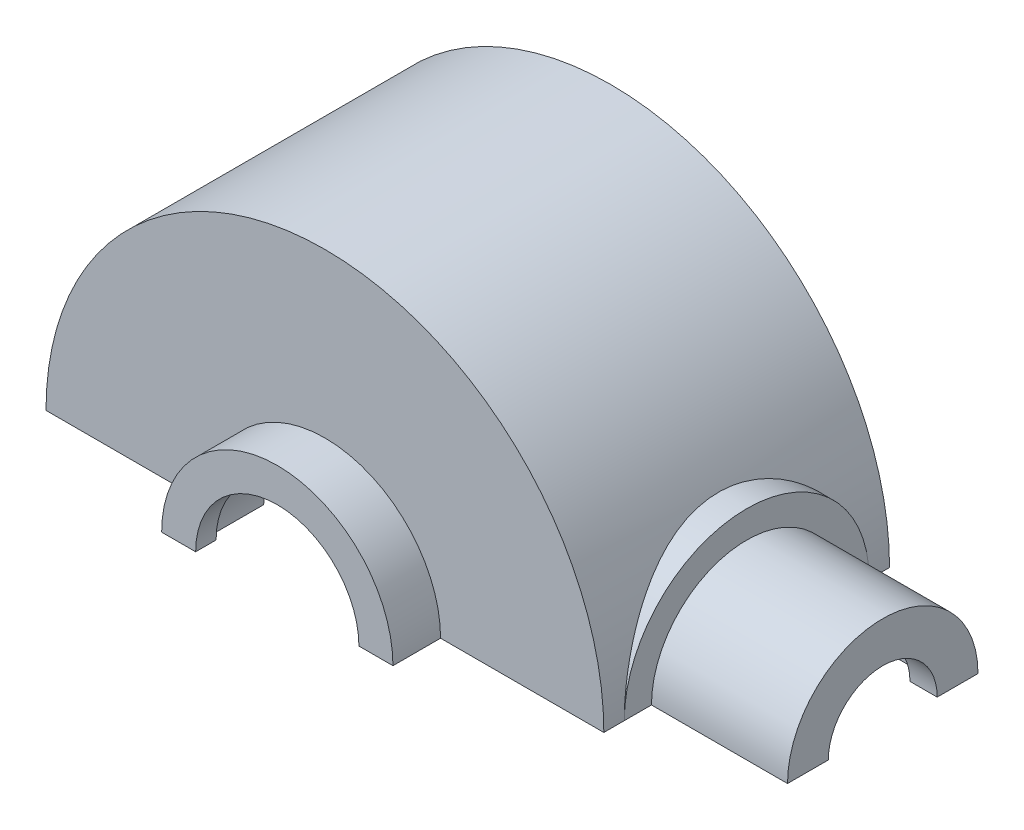
from build123d import *

# Parameters (mm, degrees)
REVOLVE1_ANGLE          = 180
SHELL1_START            = -8.5
SHELL1_DEPTH            = 17
SHELL1_START_2          = -12
SHELL1_2_DEPTH          = 24
CUT_EXTRUDE1_DEPTH      = 33.194720064
CUT_EXTRUDE1_DEPTH_BACK = 33.194720064
SKETCH3_R               = 6
BOSS_EXTRUDE1_REACH     = 49.93
SKETCH6_R               = 9
BOSS_EXTRUDE3_DEPTH     = 10
SHELL2_START            = 19.880907618
SHELL2_DEPTH            = 8.619092382
SHELL2_START_2          = -5.0000001
SHELL2_2_DEPTH          = 10.0000001
CUT_EXTRUDE2_REACH      = 41.326
SKETCH8_R               = 5
SKETCH9_R               = 4
CUT_EXTRUDE3_DEPTH      = 10
BOSS_EXTRUDE4_START     = -1
BOSS_EXTRUDE4_DEPTH     = 1
SKETCH11_R              = 2.5
CUT_EXTRUDE4_DEPTH      = 1
CUT_EXTRUDE6_DEPTH      = 12.5
CUT_EXTRUDE6_DEPTH_BACK = 12.5
SKETCH12_R              = 6.5


with BuildPart() as part:
    # Sketch2 → Revolve1 (revolve)
    with BuildSketch(Plane(origin=(0, 0, 0), x_dir=(1, 0, 0), z_dir=(0, 1, 0))):
        Polygon((0, 0), (0, 14), (-8.5, 14), (-8.5, 10.5), (-20.5, 10.5), (-20.5, 0), (-20.5, -10.5), (-8.5, -10.5), (-8.5, -14), (0, -14), align=None)
    revolve(axis=Axis((0, 0, 0), (0, 0, -1)), revolution_arc=REVOLVE1_ANGLE)

    # Shell1: read off the stored shape, not the designer's step
    # Shell1 outline → Shell1 (cut)
    with BuildSketch(Plane.XY.offset(SHELL1_START)):
        with BuildLine():
            ThreePointArc((18.5, 0), (0, 18.5), (-18.5, 0))
            Line((-18.5, 0), (18.5, 0))
        make_face()
    extrude(amount=SHELL1_DEPTH, mode=Mode.SUBTRACT)

    # Shell1 2 outline → Shell1 2 (cut)
    with BuildSketch(Plane.XY.offset(SHELL1_START_2)):
        with BuildLine():
            Line((-6.5, 0), (6.5, 0))
            ThreePointArc((6.5, 0), (0, 6.5), (-6.5, 0))
        make_face()
    extrude(amount=SHELL1_2_DEPTH, mode=Mode.SUBTRACT)

    # Sketch3 → Cut-Extrude1 (cut, two sides: drawn at the far end of the back side and taken through both)
    with BuildSketch(Plane.XY.offset(-CUT_EXTRUDE1_DEPTH_BACK)):
        Circle(SKETCH3_R)
    extrude(amount=CUT_EXTRUDE1_DEPTH + CUT_EXTRUDE1_DEPTH_BACK, mode=Mode.SUBTRACT)

    # Sketch6 → Boss-Extrude1 (add, up to next)
    with BuildSketch(Plane(origin=(20.5, 0, 0), x_dir=(0, 0, -1), z_dir=(1, 0, 0)), mode=Mode.PRIVATE) as boss_extrude1_sk1:
        Circle(SKETCH6_R)
    boss_extrude1_tool1 = extrude(boss_extrude1_sk1.sketch, amount=-BOSS_EXTRUDE1_REACH, mode=Mode.PRIVATE) - part.part
    add(boss_extrude1_tool1.solids().sort_by_distance((20.5, 0, 0))[0])

    # Sketch7 → Boss-Extrude3 (add)
    with BuildSketch(Plane(origin=(20.5, 0, 0), x_dir=(0, 0, -1), z_dir=(1, 0, 0))):
        with BuildLine():
            Line((-7, 0), (7, 0))
            ThreePointArc((7, 0), (0, 7), (-7, 0))
        make_face()
    extrude(amount=BOSS_EXTRUDE3_DEPTH)

    # Shell2: read off the stored shape, not the designer's step
    # Shell2 outline → Shell2 (cut)
    with BuildSketch(Plane.YZ.offset(SHELL2_START)):
        with BuildLine():
            ThreePointArc((0, -5), (5, 0), (0, 5))
            Line((0, 5), (0, -5))
        make_face()
    extrude(amount=SHELL2_DEPTH, mode=Mode.SUBTRACT)

    # Shell2 2 outline → Shell2 2 (add)
    with BuildSketch(Plane.XY.offset(SHELL2_START_2)):
        with BuildLine():
            Line((19.880896081, 4.999997099), (19.880907618, 0))
            Line((19.880907618, 0), (20.5, 0))
            ThreePointArc((20.5, 0), (20.344635284, 2.519090146), (19.880896081, 4.999997099))
        make_face()
    extrude(amount=SHELL2_2_DEPTH)

    # Sketch8 → Cut-Extrude2 (cut, up to next)
    with BuildSketch(Plane(origin=(0, 0, 0), x_dir=(0, 0, -1), z_dir=(1, 0, 0)), mode=Mode.PRIVATE) as cut_extrude2_sk1:
        Circle(SKETCH8_R)
    cut_extrude2_tool1 = extrude(cut_extrude2_sk1.sketch, amount=CUT_EXTRUDE2_REACH, mode=Mode.PRIVATE) & part.part
    add(cut_extrude2_tool1.solids().sort_by_distance((0, 0, 0))[0], mode=Mode.SUBTRACT)

    # Sketch9 → Cut-Extrude3 (cut)
    with BuildSketch(Plane(origin=(20.5, 0, 0), x_dir=(0, 0, -1), z_dir=(1, 0, 0))):
        Circle(SKETCH9_R)
    extrude(amount=CUT_EXTRUDE3_DEPTH, mode=Mode.SUBTRACT)

    # Sketch10 → Boss-Extrude4 (add)
    with BuildSketch(Plane(origin=(24.5, 0, 0), x_dir=(0, 0, -1), z_dir=(1, 0, 0)).offset(BOSS_EXTRUDE4_START)):
        with BuildLine():
            Line((-5, 0), (5, 0))
            ThreePointArc((5, 0), (0, 5), (-5, 0))
        make_face()
    extrude(amount=BOSS_EXTRUDE4_DEPTH)

    # Sketch11 → Cut-Extrude4 (cut)
    with BuildSketch(Plane(origin=(24.5, 0, 0), x_dir=(0, 0, -1), z_dir=(1, 0, 0))):
        Circle(SKETCH11_R)
    extrude(amount=-CUT_EXTRUDE4_DEPTH, mode=Mode.SUBTRACT)

    # Sketch12 → Cut-Extrude6 (cut, two sides: drawn at the far end of the back side and taken through both)
    with BuildSketch(Plane.XY.offset(-CUT_EXTRUDE6_DEPTH_BACK)):
        Circle(SKETCH12_R)
    extrude(amount=CUT_EXTRUDE6_DEPTH + CUT_EXTRUDE6_DEPTH_BACK, mode=Mode.SUBTRACT)


solid = part.part
